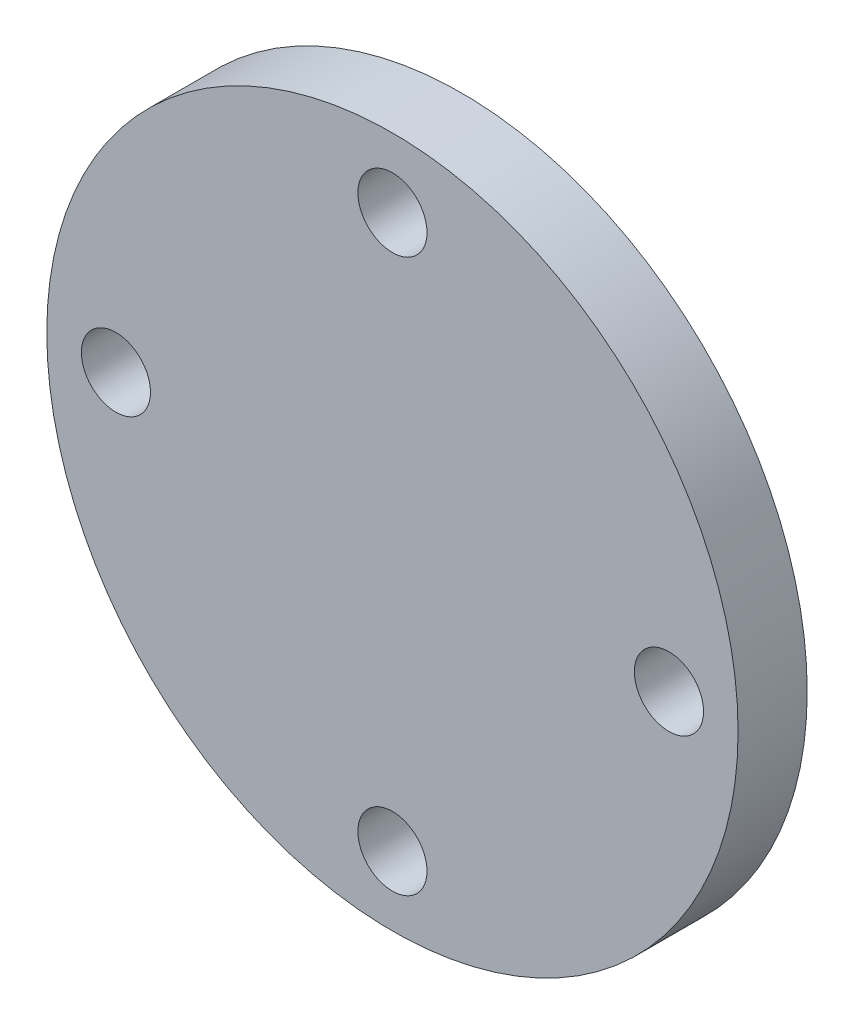
from build123d import *

# Parameters (mm, degrees)
SKETCH1_R           = 100
BOSS_EXTRUDE1_DEPTH = 20
HOLE1_START         = 2
HOLE1_OUTLINE_R     = 10
HOLE1_DEPTH         = 18
SKETCH6_R           = 10
CUT_EXTRUDE1_DEPTH  = 10


# Read off the part's stored shape, not the designer's step: Hole1
with BuildPart() as part:
    # Sketch1 → Boss-Extrude1 (new body)
    with BuildSketch(Plane(origin=(0, 0, 0), x_dir=(0, 1, 0), z_dir=(0, 0, 1))):
        with Locations(Location((0, 0, 0), (0, 0, 270))):
            Circle(SKETCH1_R)
    extrude(amount=BOSS_EXTRUDE1_DEPTH)

    # Hole1 outline → Hole1 (cut)
    with BuildSketch(Plane.XY.offset(HOLE1_START)):
        with Locations((-80, 0)):
            Circle(HOLE1_OUTLINE_R)
        with Locations((0, -80)):
            Circle(HOLE1_OUTLINE_R)
        with Locations((0, 80)):
            Circle(HOLE1_OUTLINE_R)
        with Locations((80, 0)):
            Circle(HOLE1_OUTLINE_R)
    extrude(amount=HOLE1_DEPTH, mode=Mode.SUBTRACT)

    # Sketch6 → Cut-Extrude1 (cut)
    with BuildSketch(Plane(origin=(0, 0, 0), x_dir=(1, 0, 0), z_dir=(0, 0, -1))):
        with Locations(Location((0, 0, 0), (0, 0, 180))):
            Circle(SKETCH6_R)
    extrude(amount=-CUT_EXTRUDE1_DEPTH, mode=Mode.SUBTRACT)


solid = part.part
